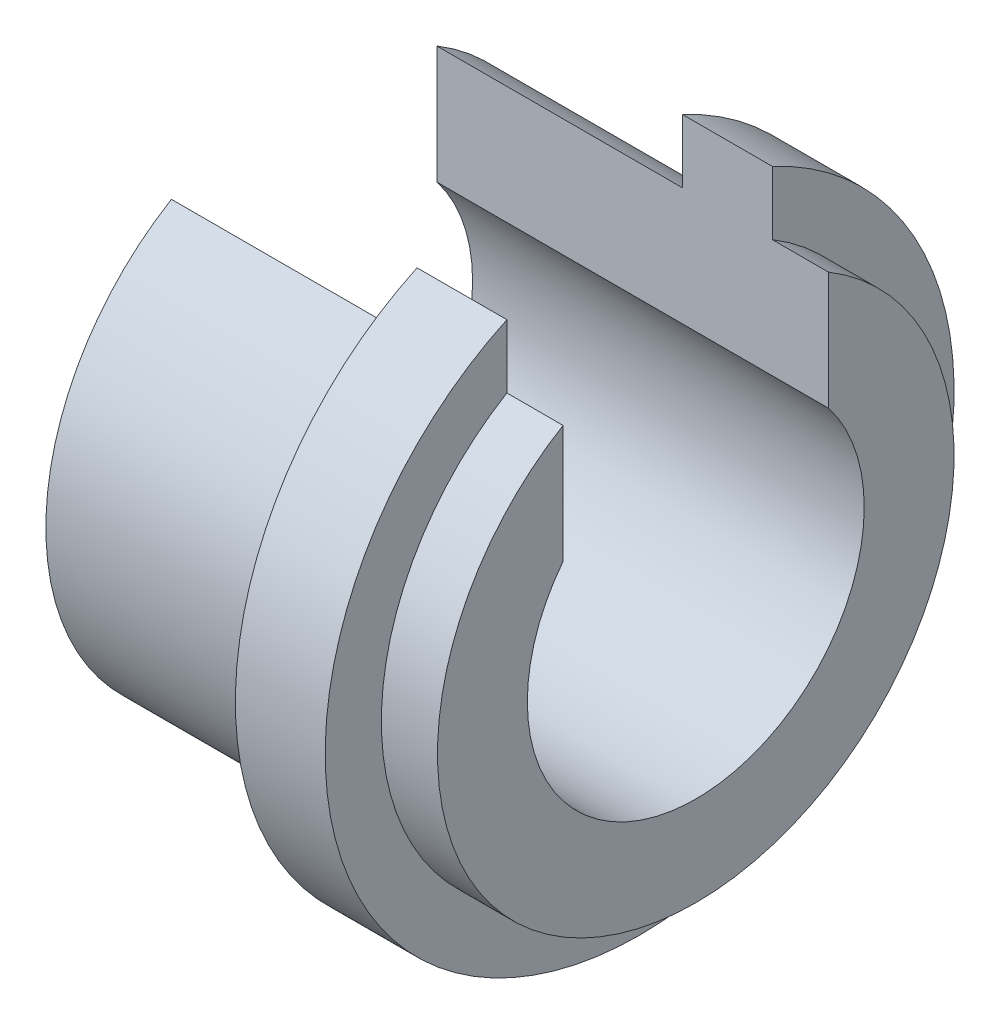
from build123d import *

# Parameters (mm, degrees)
CUT_EXTRUDE1_DEPTH      = 17.753249734
CUT_EXTRUDE1_DEPTH_BACK = 17.753249734


with BuildPart() as part:
    # Sketch1 → Revolve1 (revolve)
    with BuildSketch(Plane.XY):
        Polygon((0, 4.7625), (0, 7.3025), (-1.5875, 7.3025), (-1.5875, 8.89), (-4.1275, 8.89), (-4.1275, 7.3025), (-11.0728125, 7.3025), (-11.0728125, 4.7625), align=None)
    revolve(axis=Axis((0, 0, 0), (-1, 0, 0)))

    # Sketch2 → Cut-Extrude1 (cut, two sides: drawn at the far end of the back side and taken through both)
    with BuildSketch(Plane(origin=(0, 0, 0), x_dir=(0, 0, -1), z_dir=(1, 0, 0)).offset(-CUT_EXTRUDE1_DEPTH_BACK)):
        with BuildLine():
            Line((-3.753074004, 2.931866602), (-3.753074004, 8.05894134))
            ThreePointArc((-3.753074004, 8.05894134), (0, 8.89), (3.753074004, 8.05894134))
            Line((3.753074004, 8.05894134), (3.753074004, 2.931866602))
            ThreePointArc((3.753074004, 2.931866602), (0, 4.7625), (-3.753074004, 2.931866602))
        make_face()
    extrude(amount=CUT_EXTRUDE1_DEPTH + CUT_EXTRUDE1_DEPTH_BACK, mode=Mode.SUBTRACT)


solid = part.part
